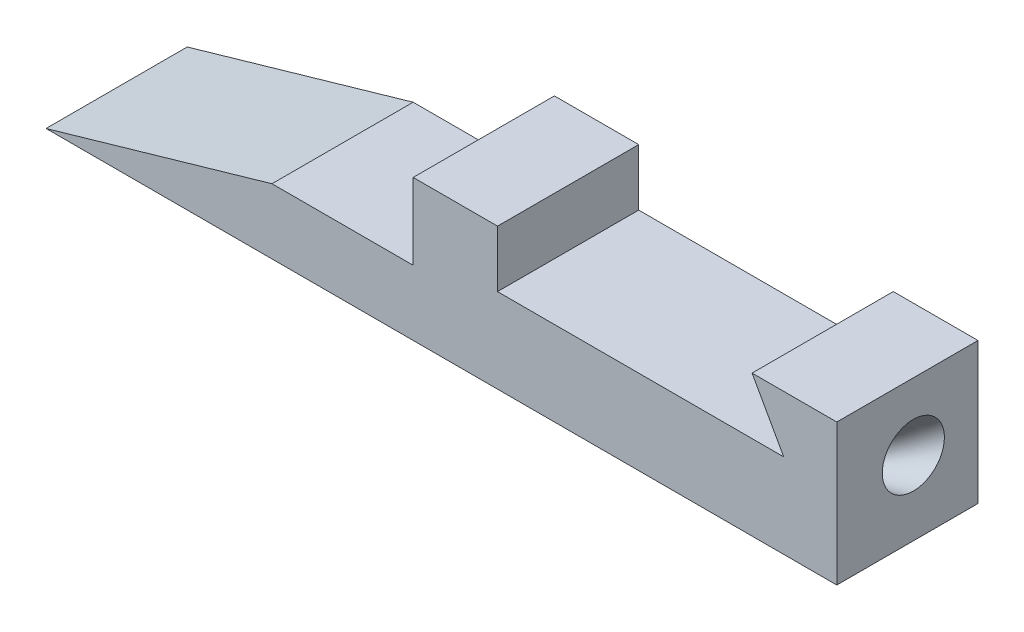
from build123d import *

# Parameters (mm, degrees)
SKETCH1_W           = 15
SKETCH1_H           = 5
BOSS_EXTRUDE1_DEPTH = 5
CUT_EXTRUDE1_DEPTH  = 5
SKETCH3_W           = 5
SKETCH3_H           = 2.306580292
BOSS_EXTRUDE2_DEPTH = 5
BOSS_EXTRUDE3_DEPTH = 5


with BuildPart() as part:
    # Sketch1 → Boss-Extrude1 (new body)
    with BuildSketch(Plane(origin=(0, 0, 0), x_dir=(1, 0, 0), z_dir=(0, 1, 0))):
        with Locations((7.5, 2.5)):
            Rectangle(SKETCH1_W, SKETCH1_H)
    extrude(amount=BOSS_EXTRUDE1_DEPTH)

    # Sketch2 → Cut-Extrude1 (cut)
    with BuildSketch(Plane.XY):
        Polygon((3, 5), (12, 5), (13.120394862, 2.991339911), (2.986234937, 2.991339911), (2.986234937, 5), align=None)
    extrude(amount=-CUT_EXTRUDE1_DEPTH, mode=Mode.SUBTRACT)

    # Sketch3 → Boss-Extrude2 (add)
    with BuildSketch(Plane.ZY):
        with Locations((-2.5, 1.153290146)):
            Rectangle(SKETCH3_W, SKETCH3_H)
    extrude(amount=BOSS_EXTRUDE2_DEPTH)

    # Sketch7 → Boss-Extrude3 (add)
    with BuildSketch(Plane.XY):
        Polygon((-5, 0), (-13.001867805, 0), (-5, 2.306580292), align=None)
    extrude(amount=-BOSS_EXTRUDE3_DEPTH)

    # Cut-Loft1: read off the stored shape, not the designer's step
    # Cut-Loft1: loft between two sections, ruled curve by curve
    cut_loft1_from = [
        Edge.make_bspline([(10.775857545, 0, -3.733497041), (10.684223664, 0, -3.733497041), (10.580567417, 0, -3.722354361), (10.355367989, 0, -3.656671194), (10.233384966, 0, -3.601544251), (9.998802229, 0, -3.425607198), (9.886786943, 0, -3.303547063), (9.724445949, 0, -2.999157699), (9.676250966, 0, -2.817158224), (9.676250966, 0, -2.450622698), (9.724445949, 0, -2.268623224), (9.886786943, 0, -1.964233859), (9.998802229, 0, -1.842173724), (10.233384966, 0, -1.666236672), (10.355367989, 0, -1.611109728), (10.580567417, 0, -1.545426562), (10.684223664, 0, -1.534283882), (10.867491427, 0, -1.534283882), (10.971147674, 0, -1.545426562), (11.196347101, 0, -1.611109728), (11.318330124, 0, -1.666236672), (11.552912861, 0, -1.842173724), (11.664928148, 0, -1.964233859), (11.827269142, 0, -2.268623224), (11.875464125, 0, -2.450622698), (11.875464125, 0, -2.817158224), (11.827269142, 0, -2.999157699), (11.664928148, 0, -3.303547063), (11.552912861, 0, -3.425607198), (11.318330124, 0, -3.601544251), (11.196347101, 0, -3.656671194), (10.971147674, 0, -3.722354361), (10.867491427, 0, -3.733497041), (10.775857545, 0, -3.733497041)], [0, 0, 0, 0, 0.0625, 0.0625, 0.125, 0.125, 0.1875, 0.1875, 0.25, 0.25, 0.3125, 0.3125, 0.375, 0.375, 0.4375, 0.4375, 0.5, 0.5, 0.5625, 0.5625, 0.625, 0.625, 0.6875, 0.6875, 0.75, 0.75, 0.8125, 0.8125, 0.875, 0.875, 0.9375, 0.9375, 1, 1, 1, 1], 3),
    ]
    cut_loft1_to = [
        Edge.make_bspline([(15, 1.571629768, -3.022785324), (15, 1.59774719, -3.110618396), (15, 1.637971718, -3.206799289), (15, 1.765116639, -3.403936879), (15, 1.852724527, -3.505148024), (15, 2.088224624, -3.67985524), (15, 2.237148437, -3.752434842), (15, 2.575182586, -3.821285391), (15, 2.763369546, -3.815607976), (15, 3.114701834, -3.71113829), (15, 3.275415798, -3.613068993), (15, 3.520909325, -3.370704781), (15, 3.60598011, -3.228546199), (15, 3.70775901, -2.953548085), (15, 3.725831875, -2.820912459), (15, 3.724604446, -2.586332933), (15, 3.705740921, -2.483800283), (15, 3.653506078, -2.308134139), (15, 3.61328155, -2.211953246), (15, 3.486136629, -2.014815656), (15, 3.398528741, -1.913604511), (15, 3.163028644, -1.738897295), (15, 3.014104831, -1.666317693), (15, 2.676070682, -1.597467144), (15, 2.487883722, -1.603144559), (15, 2.136551433, -1.707614245), (15, 1.97583747, -1.805683542), (15, 1.730343943, -2.048047754), (15, 1.645273158, -2.190206336), (15, 1.543494258, -2.46520445), (15, 1.525421393, -2.597840076), (15, 1.526648822, -2.832419602), (15, 1.545512347, -2.934952252), (15, 1.571629768, -3.022785324)], [0, 0, 0, 0, 0.0625, 0.0625, 0.125, 0.125, 0.1875, 0.1875, 0.25, 0.25, 0.3125, 0.3125, 0.375, 0.375, 0.4375, 0.4375, 0.5, 0.5, 0.5625, 0.5625, 0.625, 0.625, 0.6875, 0.6875, 0.75, 0.75, 0.8125, 0.8125, 0.875, 0.875, 0.9375, 0.9375, 1, 1, 1, 1], 3),
    ]
    cut_loft1 = Solid(Shell([*[Face.make_surface_from_curves(cut_loft1_from[k], cut_loft1_to[k]) for k in range(1)], Face(Wire(cut_loft1_from)), Face(Wire(cut_loft1_to))]))
    add(cut_loft1, mode=Mode.SUBTRACT)


solid = part.part
